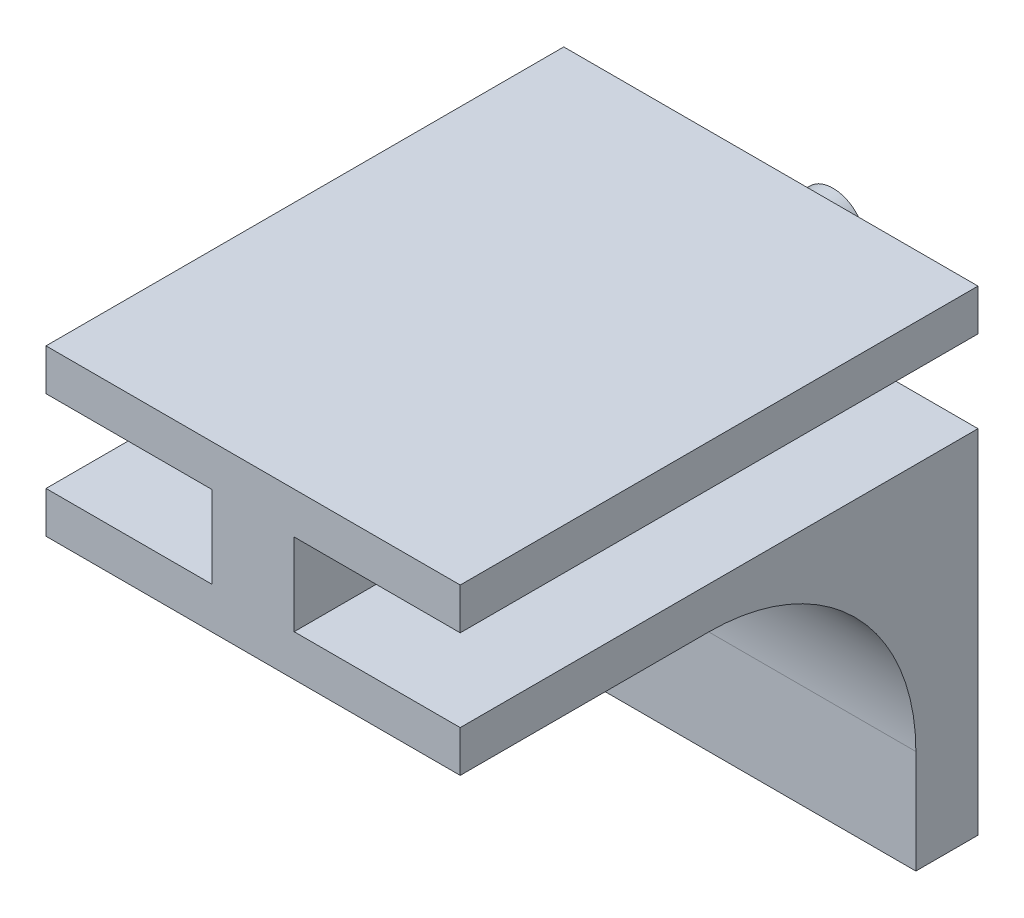
from build123d import *

# Parameters (mm, degrees)
BOSS_EXTRUDE1_DEPTH = 25
SKETCH2_W           = 20
SKETCH2_H           = 3
BOSS_EXTRUDE2_DEPTH = 15
FILLET1_R           = 10
SKETCH3_R           = 1.5748
BOSS_EXTRUDE3_DEPTH = 3


with BuildPart() as part:
    # Sketch1 → Boss-Extrude1 (new body)
    with BuildSketch(Plane.XY):
        Polygon((10, -3.9812), (-10, -3.9812), (-10, -1.9812), (-1.9812, -1.9812), (-1.9812, 1.9812), (-10, 1.9812), (-10, 3.9812), (10, 3.9812), (10, 1.9812), (1.9812, 1.9812), (1.9812, -1.9812), (10, -1.9812), align=None)
    extrude(amount=BOSS_EXTRUDE1_DEPTH)

    # Sketch2 → Boss-Extrude2 (add)
    with BuildSketch(Plane.XZ.offset(3.9812)):
        with Locations((0, 1.5)):
            Rectangle(SKETCH2_W, SKETCH2_H)
    extrude(amount=BOSS_EXTRUDE2_DEPTH)

    # Fillet1
    fillet1_edges = [part.edges().sort_by_distance(p)[0] for p in [
        (0, -3.9812, 3),
    ]]
    fillet(fillet1_edges, radius=FILLET1_R)

    # Sketch3 → Boss-Extrude3 (add)
    with BuildSketch(Plane(origin=(0, 0, 0), x_dir=(-1, 0, 0), z_dir=(0, 0, -1))):
        Circle(SKETCH3_R)
    extrude(amount=BOSS_EXTRUDE3_DEPTH)


solid = part.part
